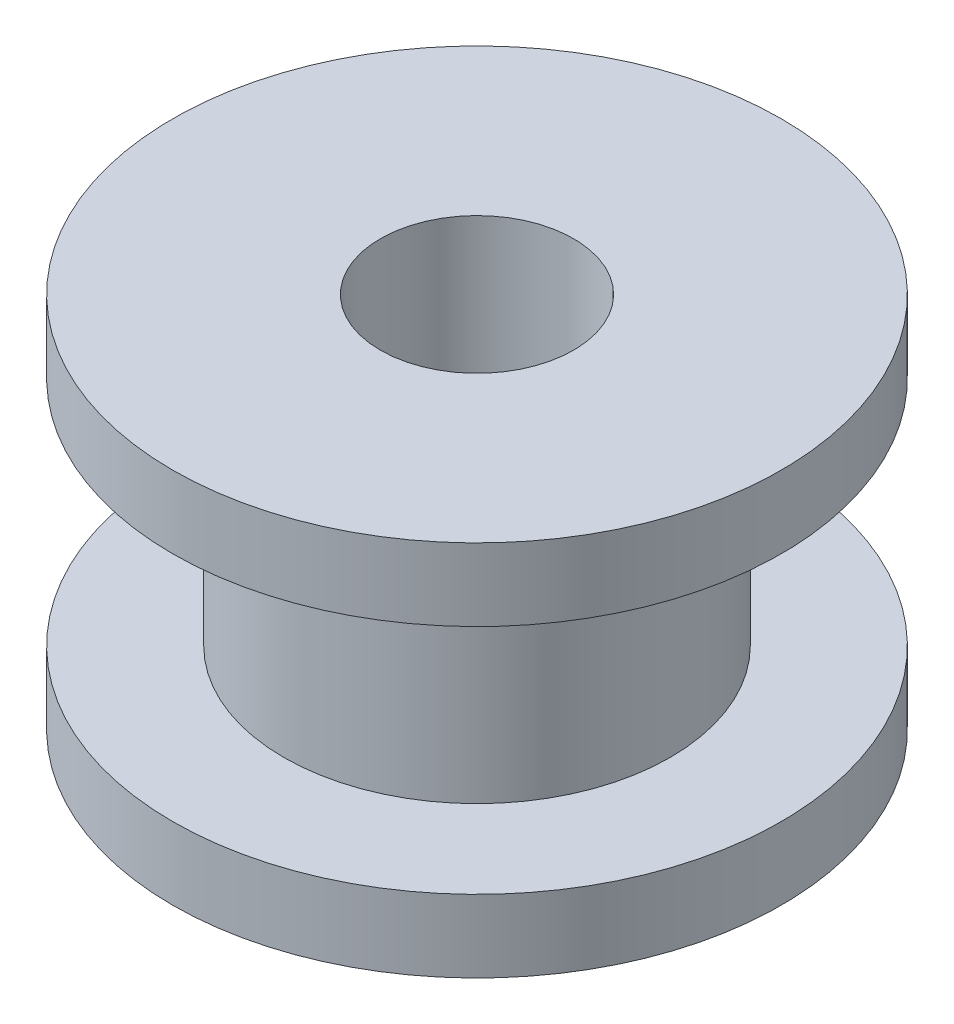
from build123d import *

# Parameters (mm, degrees)
SKETCH1_R           = 8
SKETCH1_R_2         = 2.54
BOSS_EXTRUDE1_DEPTH = 9.906
SKETCH2_R           = 8
SKETCH2_R_2         = 5.08
CUT_EXTRUDE1_DEPTH  = 6.096


with BuildPart() as part:
    # Sketch1 → Boss-Extrude1 (new body)
    with BuildSketch(Plane(origin=(0, 0, 0), x_dir=(1, 0, 0), z_dir=(0, 1, 0))):
        Circle(SKETCH1_R)
        Circle(SKETCH1_R_2, mode=Mode.SUBTRACT)
    extrude(amount=BOSS_EXTRUDE1_DEPTH)

    # Sketch2 → Cut-Extrude1 (cut)
    with BuildSketch(Plane(origin=(0, 1.905, 0), x_dir=(1, 0, 0), z_dir=(0, 1, 0))):
        Circle(SKETCH2_R)
        Circle(SKETCH2_R_2, mode=Mode.SUBTRACT)
    extrude(amount=CUT_EXTRUDE1_DEPTH, mode=Mode.SUBTRACT)


solid = part.part
